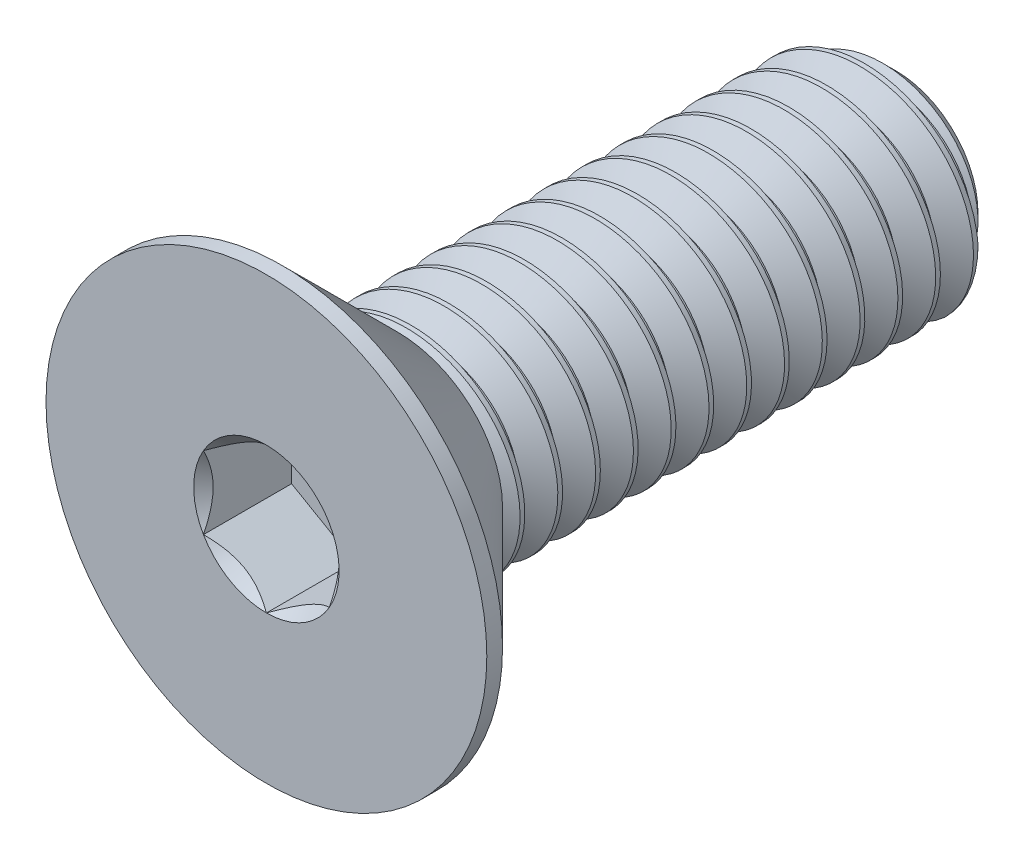
from build123d import *
from build123d.topology import SkipClean

# Parameters (mm, degrees)
SKETCH1_W          = 10
SKETCH1_H          = 1.75
CHAMFER1_SIZE      = 0.45
CUT_SWEEP1_PITCH   = 0.6
CUT_EXTRUDE2_DEPTH = 1.4


with BuildPart() as part:
    # Sketch1 → Revolve1 (revolve)
    with BuildSketch(Plane(origin=(0, 0, 0), x_dir=(0, 0, -1), z_dir=(1, 0, 0))):
        with Locations((5, 0.875)):
            Rectangle(SKETCH1_W, SKETCH1_H)
    revolve(axis=Axis((0, 0, -10), (0, 0, 1)))

    # Chamfer1
    chamfer1_edges = [part.edges().sort_by_distance(p)[0] for p in [
        (0, -1.75, -10),
    ]]
    chamfer(chamfer1_edges, length=CHAMFER1_SIZE)

    # Cut-Sweep1: the profile of Sketch2 profile screwed along a right-hand helix of 16.666667 turns, 6 arcs to a turn; built about Z, then put on its axis
    with SkipClean():  # the faces are left unmerged after this step: merging them gives an invalid solid
        cut_sweep1_z = Axis((0, 0, 0), (0, 0, 1))
        cut_sweep1_corners = [(1.7506, 0, 0.00034641), (1.7506, 0, -0.52534641), (1.360288568, 0, -0.3), (1.360288568, 0, -0.225)]
        with BuildLine(mode=Mode.PRIVATE) as cut_sweep1_profile:
            Line(cut_sweep1_corners[0], cut_sweep1_corners[1])
            Line(cut_sweep1_corners[1], cut_sweep1_corners[2])
            Line(cut_sweep1_corners[2], cut_sweep1_corners[3])
            Line(cut_sweep1_corners[3], cut_sweep1_corners[0])
        cut_sweep1_cap = Face(cut_sweep1_profile.wire())
        cut_sweep1_turn_angles = [0, 30, 60, 90, 120, 150, 180, 210, 240, 270, 300, 330, 360]
        cut_sweep1_turn_weights = [1, 0.8660254037844387, 1, 0.8660254037844387, 1, 0.8660254037844387, 1, 0.8660254037844387, 1, 0.8660254037844387, 1, 0.8660254037844387, 1]
        cut_sweep1_turn_rails = [Edge.make_bspline([Vector(p[0], p[1], 0).rotate(cut_sweep1_z, cut_sweep1_turn_angles[k]) / cut_sweep1_turn_weights[k] + Vector(0, 0, p[2] + CUT_SWEEP1_PITCH * cut_sweep1_turn_angles[k] / 360) for k in range(13)], [0, 0, 0, 1, 1, 2, 2, 3, 3, 4, 4, 5, 5, 6, 6, 6], 2, cut_sweep1_turn_weights) for p in cut_sweep1_corners]
        cut_sweep1_turn_sides = [Face.make_surface_from_curves(cut_sweep1_turn_rails[p[0]], cut_sweep1_turn_rails[p[1]]) for p in [(0, 1), (1, 2), (2, 3), (3, 0)]]
        cut_sweep1_last_angles = [5760, 5790, 5820, 5850, 5880, 5910, 5940, 5970, 6000]
        cut_sweep1_last_weights = [1, 0.8660254037844387, 1, 0.8660254037844387, 1, 0.8660254037844387, 1, 0.8660254037843037, 1]
        cut_sweep1_last_rails = [Edge.make_bspline([Vector(p[0], p[1], 0).rotate(cut_sweep1_z, cut_sweep1_last_angles[k]) / cut_sweep1_last_weights[k] + Vector(0, 0, p[2] + CUT_SWEEP1_PITCH * cut_sweep1_last_angles[k] / 360) for k in range(9)], [0, 0, 0, 1, 1, 2, 2, 3, 3, 4, 4, 4], 2, cut_sweep1_last_weights) for p in cut_sweep1_corners]
        cut_sweep1_last_sides = [Face.make_surface_from_curves(cut_sweep1_last_rails[p[0]], cut_sweep1_last_rails[p[1]]) for p in [(0, 1), (1, 2), (2, 3), (3, 0)]]
        cut_sweep1 = Plane(origin=(0, 0, -10), x_dir=(0, 1, 0), z_dir=(0, 0, 1)) * Solid(Shell([*[p.moved(Location((0, 0, CUT_SWEEP1_PITCH * i))) for i in range(16) for p in cut_sweep1_turn_sides], *cut_sweep1_last_sides, cut_sweep1_cap, cut_sweep1_cap.rotate(cut_sweep1_z, 6000).moved(Location((0, 0, CUT_SWEEP1_PITCH * 6000 / 360)))]))
        add(cut_sweep1, mode=Mode.SUBTRACT)

    # Sketch7 → Revolve2 (revolve)
    with BuildSketch(Plane(origin=(0, 0, 0), x_dir=(0, 0, -1), z_dir=(1, 0, 0)), mode=Mode.PRIVATE) as revolve2_sk:
        Polygon((0, 3.5), (0.25, 3.5), (2, 1.75), (2, 0), (0, 0), align=None)
    revolve(revolve2_sk.sketch.rotate(Axis((0, 0, 0), (0, 0, -1)), 189.336081704), axis=Axis((0, 0, 0), (0, 0, -1)))

    # Boss-Extrude1 cone 1 section (through the dimple's axis) → Boss-Extrude1 (revolve)
    with SkipClean():  # the faces are left unmerged after this step: merging them gives an invalid solid
        with BuildSketch(Plane(origin=(0, 0, -2), x_dir=(0, -1, 0), z_dir=(1, 0, 0))):
            Polygon((0, 0), (1.75, 0), (0, 1.75), align=None)
        revolve(axis=Axis((0, 0, -2), (0, 0, -1)))

    # Sketch5 → Cut-Extrude2 (cut)
    with SkipClean():  # the faces are left unmerged after this step: merging them gives an invalid solid
        with BuildSketch(Plane.XY):
            Polygon((1, -0.577350269), (1, 0.577350269), (0, 1.154700538), (-1, 0.577350269), (-1, -0.577350269), (0, -1.154700538), align=None)
        extrude(amount=-CUT_EXTRUDE2_DEPTH, mode=Mode.SUBTRACT)

    # Cut-Extrude3 cone 1 section (through the dimple's axis) → Cut-Extrude3 (revolve, cut)
    with SkipClean():  # the faces are left unmerged after this step: merging them gives an invalid solid
        with BuildSketch(Plane(origin=(0, 0, 0), x_dir=(0, -1, 0), z_dir=(1, 0, 0))):
            Polygon((0, 0), (1.154700538, 0), (0, 1.154700538), align=None)
        revolve(axis=Axis((0, 0, 0), (0, 0, -1)), mode=Mode.SUBTRACT)


solid = part.part
